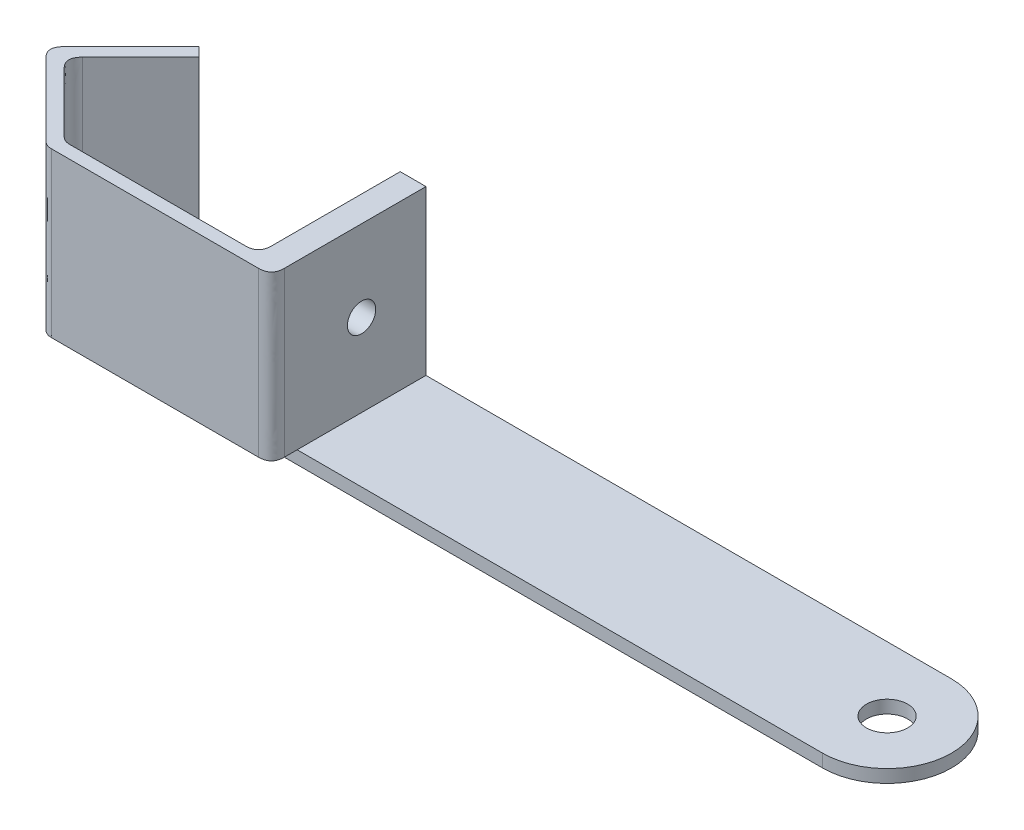
from build123d import *

# Parameters (mm, degrees)
SKETCH1_R                   = 4.064
BOSS_EXTRUDE1_DEPTH         = 2.54
SKETCH2_W                   = 30.48
SKETCH2_H                   = 32.258
BOSS_EXTRUDE2_DEPTH         = 5.08
SKETCH3_W                   = 41.91
SKETCH3_H                   = 32.258
BOSS_EXTRUDE3_DEPTH         = 2.54
FILLET1_SIZE                = 2.54
CUT_EXTRUDE1_DEPTH          = 158.565599432
SKETCH5_W                   = 17.78
SKETCH5_H                   = 32.258
BOSS_EXTRUDE4_DEPTH         = 2.54
BOSS_EXTRUDE5_DEPTH         = 32.258
SKETCH9_W                   = 18.796
SKETCH9_H                   = 32.258
BOSS_EXTRUDE6_DEPTH         = 2.54
BOSS_EXTRUDE7_DEPTH         = 32.258
FILLET3_SIZE                = 2.54
W_0_22_DIAMETER_HOLE1_D     = 5.588
W_0_22_DIAMETER_HOLE1_DEPTH = 5.08
W_0_22_DIAMETER_HOLE1_TIP   = 1.67880457


with BuildPart() as part:
    # Sketch1 → Boss-Extrude1 (new body)
    with BuildSketch(Plane(origin=(0, 0, 0), x_dir=(1, 0, 0), z_dir=(0, 1, 0))):
        with BuildLine():
            Line((0, 0), (-108.712, 0))
            Line((-108.712, 0), (-108.712, -25.4))
            Line((-108.712, -25.4), (0, -25.4))
            ThreePointArc((0, -25.4), (12.7, -12.7), (0, 0))
        make_face()
        with Locations(Location((0, -12.7, 0), (0, 0, 270))):
            Circle(SKETCH1_R, mode=Mode.SUBTRACT)
    extrude(amount=-BOSS_EXTRUDE1_DEPTH)

    # Sketch2 → Boss-Extrude2 (add)
    with BuildSketch(Plane(origin=(-108.712, 0, 0), x_dir=(0, 0, -1), z_dir=(1, 0, 0))):
        with Locations((-15.24, 16.129)):
            Rectangle(SKETCH2_W, SKETCH2_H)
    extrude(amount=BOSS_EXTRUDE2_DEPTH)

    # Sketch3 → Boss-Extrude3 (add)
    with BuildSketch(Plane.XY.offset(30.48)):
        with Locations((-129.667, 16.129)):
            Rectangle(SKETCH3_W, SKETCH3_H)
    extrude(amount=-BOSS_EXTRUDE3_DEPTH)

    # Fillet1
    # a fillet whose section is not a circle: 2.54 mm, written as the material it adds along each edge
    with BuildSketch(Plane(origin=(-108.712, 0, 27.94), x_dir=(0, 0, -1), z_dir=(0, 1, 0))) as fillet1_piece_1:
        with BuildLine():
            Bezier((FILLET1_SIZE, 0), (0, 0), (0, FILLET1_SIZE), weights=[1, 1, 1])
            Line((0, FILLET1_SIZE), (0, 0))
            Line((0, 0), (FILLET1_SIZE, 0))
        make_face()
    extrude(amount=32.258)
    # a fillet whose section is not a circle: 2.54 mm, written as the material it takes off along each edge
    with BuildSketch(Plane(origin=(-103.632, -6.35, 30.48), x_dir=(0, 0, -1), z_dir=(0, 1, 0))) as fillet1_2_piece_1:
        with BuildLine():
            Bezier((FILLET1_SIZE, 0), (0, 0), (0, FILLET1_SIZE), weights=[1, 1, 1])
            Line((0, FILLET1_SIZE), (0, 0))
            Line((0, 0), (FILLET1_SIZE, 0))
        make_face()
    extrude(amount=44.958, mode=Mode.SUBTRACT)

    # Sketch4 → Cut-Extrude1 (cut, through all)
    with BuildSketch(Plane(origin=(0, 32.258, 0), x_dir=(1, 0, 0), z_dir=(0, 1, 0))):
        Polygon((-150.622, -27.94), (-148.082, -30.48), (-150.622, -30.48), align=None)
    extrude(amount=-CUT_EXTRUDE1_DEPTH, mode=Mode.SUBTRACT)



with BuildPart() as body_2:
    # Sketch5 → Boss-Extrude4 (new body)
    with BuildSketch(Plane(origin=(-89.281, 0, 89.281), x_dir=(0.7071067811865327, 0, 0.7071067811865624), z_dir=(-0.7071067811865624, 0, 0.7071067811865327))):
        with Locations((-95.63927413, 16.129)):
            Rectangle(SKETCH5_W, SKETCH5_H)
    extrude(amount=-BOSS_EXTRUDE4_DEPTH)


with BuildPart() as part_1:
    add(part.part)

    add(body_2.part)  # Boss-Extrude5 merges body 2
    # Sketch6 → Boss-Extrude5 (add)
    with BuildSketch(Plane(origin=(0, 32.258, 0), x_dir=(1, 0, 0), z_dir=(0, 1, 0))):
        Polygon((-150.622, -27.94), (-147.029897552, -27.94), (-148.825948776, -26.143948776), align=None)
    extrude(amount=-BOSS_EXTRUDE5_DEPTH)

    # Fillet2
    # a fillet whose section is not a circle: 2.54 mm, written as the material it adds along each edge
    with BuildSketch(Plane(origin=(-147.029897552, 32.258, 27.94), x_dir=(-0.7071067811865357, 0, -0.7071067811865592), z_dir=(0, -1, 0))) as fillet2_piece_1:
        with BuildLine():
            Bezier((1.052102448, 0), (0, 0), (-0.743948776, 0.743948776), weights=[1, 1, 1])
            Line((-0.743948776, 0.743948776), (0, 0))
            Line((0, 0), (1.052102448, 0))
        make_face()
    extrude(amount=32.258)
    # a fillet whose section is not a circle: 2.54 mm, written as the material it takes off along each edge
    with BuildSketch(Plane(origin=(-148.082, 34.888256121, 30.48), x_dir=(-0.707106781186539, 0, -0.707106781186556), z_dir=(0, -1, 0))) as fillet2_2_piece_1:
        with BuildLine():
            Bezier((1.052102448, 0), (0, 0), (-0.743948776, 0.743948776), weights=[1, 1, 1])
            Line((-0.743948776, 0.743948776), (0, 0))
            Line((0, 0), (1.052102448, 0))
        make_face()
    extrude(amount=37.518512242, mode=Mode.SUBTRACT)



with BuildPart() as body_2_2:
    # Sketch9 → Boss-Extrude6 (new body)
    with BuildSketch(Plane(origin=(-73.913358569, 0, -73.913358569), x_dir=(-0.7071067811865623, 0, 0.7071067811865328), z_dir=(-0.7071067811865328, 0, -0.7071067811865623))):
        with Locations((114.324401062, 16.129)):
            Rectangle(SKETCH9_W, SKETCH9_H)
    extrude(amount=BOSS_EXTRUDE6_DEPTH)


with BuildPart() as part_2:
    add(part_1.part)

    add(body_2_2.part)  # Boss-Extrude7 merges body 2 2
    # Sketch10 → Boss-Extrude7 (add)
    with BuildSketch(Plane(origin=(0, 0, 0), x_dir=(1, 0, 0), z_dir=(0, 1, 0))):
        Polygon((-161.398307345, -13.571590206), (-163.194358569, -11.775538982), (-164.990409794, -13.571590206), (-163.194358569, -15.367641431), align=None)
    extrude(amount=BOSS_EXTRUDE7_DEPTH)

    # Fillet3
    # a fillet whose section is not a circle: 2.54 mm, written as the material it adds along each edge
    with BuildSketch(Plane(origin=(-161.398307345, 32.258, 13.571590206), x_dir=(0.7071067811865611, 0, -0.7071067811865339), z_dir=(0, -1, 0))) as fillet3_piece_1:
        with BuildLine():
            Bezier((FILLET3_SIZE, 0), (0, 0), (0, FILLET3_SIZE), weights=[1, 1, 1])
            Line((0, FILLET3_SIZE), (0, 0))
            Line((0, 0), (FILLET3_SIZE, 0))
        make_face()
    extrude(amount=32.258)
    # a fillet whose section is not a circle: 2.54 mm, written as the material it takes off along each edge
    with BuildSketch(Plane(origin=(-164.990409794, -6.35, 13.571590206), x_dir=(0.7071067811865199, 0, 0.7071067811865752), z_dir=(0, 1, 0))) as fillet3_2_piece_1:
        with BuildLine():
            Bezier((FILLET3_SIZE, 0), (0, 0), (0, FILLET3_SIZE), weights=[1, 1, 1])
            Line((0, FILLET3_SIZE), (0, 0))
            Line((0, 0), (FILLET3_SIZE, 0))
        make_face()
    extrude(amount=44.958, mode=Mode.SUBTRACT)

    # W (0.22) Diameter Hole1
    with Locations(Plane(origin=(-103.632, 16.256, 12.7), x_dir=(0, 0, 1), z_dir=(1, 0, 0))):
        with Locations((0, 0)):
            Hole(W_0_22_DIAMETER_HOLE1_D / 2, depth=W_0_22_DIAMETER_HOLE1_DEPTH)
            with Locations((0, 0, -(W_0_22_DIAMETER_HOLE1_DEPTH + W_0_22_DIAMETER_HOLE1_TIP / 2))):  # 118° drill point
                Cone(0, W_0_22_DIAMETER_HOLE1_D / 2, W_0_22_DIAMETER_HOLE1_TIP, mode=Mode.SUBTRACT)


solid = part_2.part
